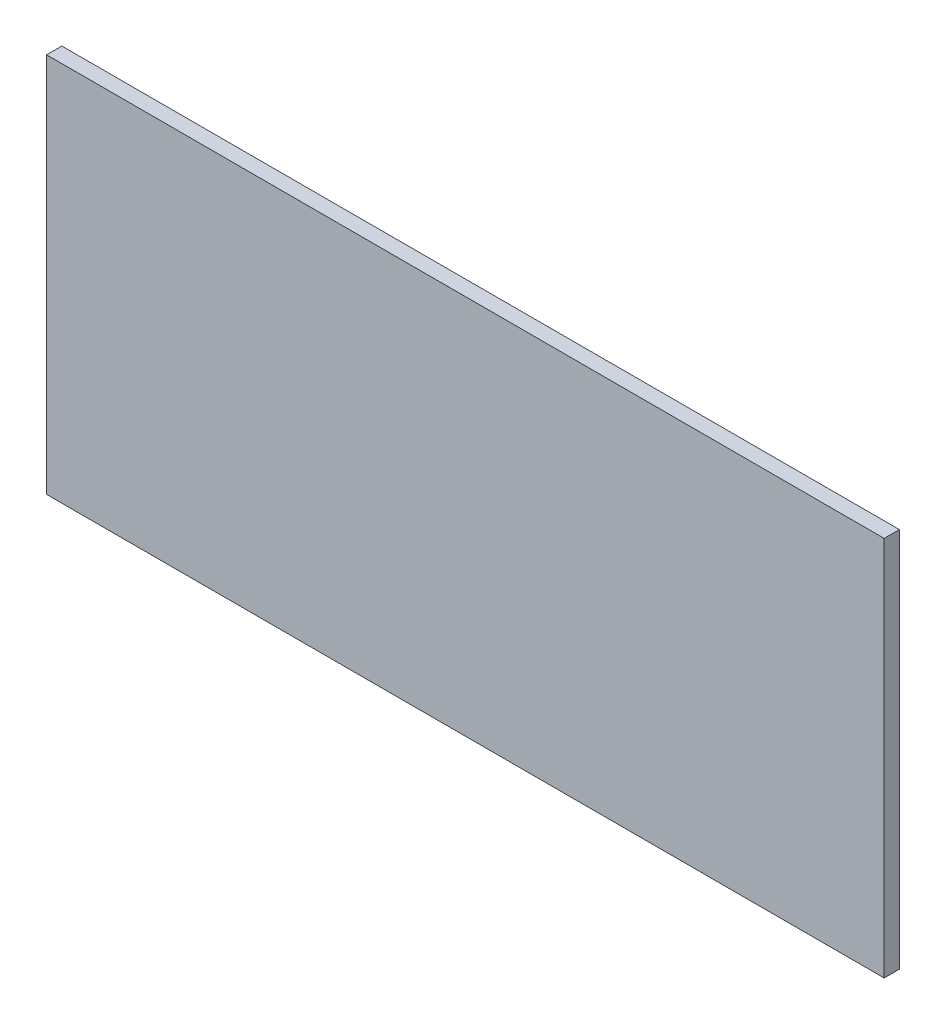
from build123d import *

# Parameters (mm, degrees)
SKETCH1_W           = 55
SKETCH1_H           = 25
BOSS_EXTRUDE1_DEPTH = 1


with BuildPart() as part:
    # Sketch1 → Boss-Extrude1 (new body)
    with BuildSketch(Plane.XY):
        Rectangle(SKETCH1_W, SKETCH1_H)
    extrude(amount=BOSS_EXTRUDE1_DEPTH)


solid = part.part
